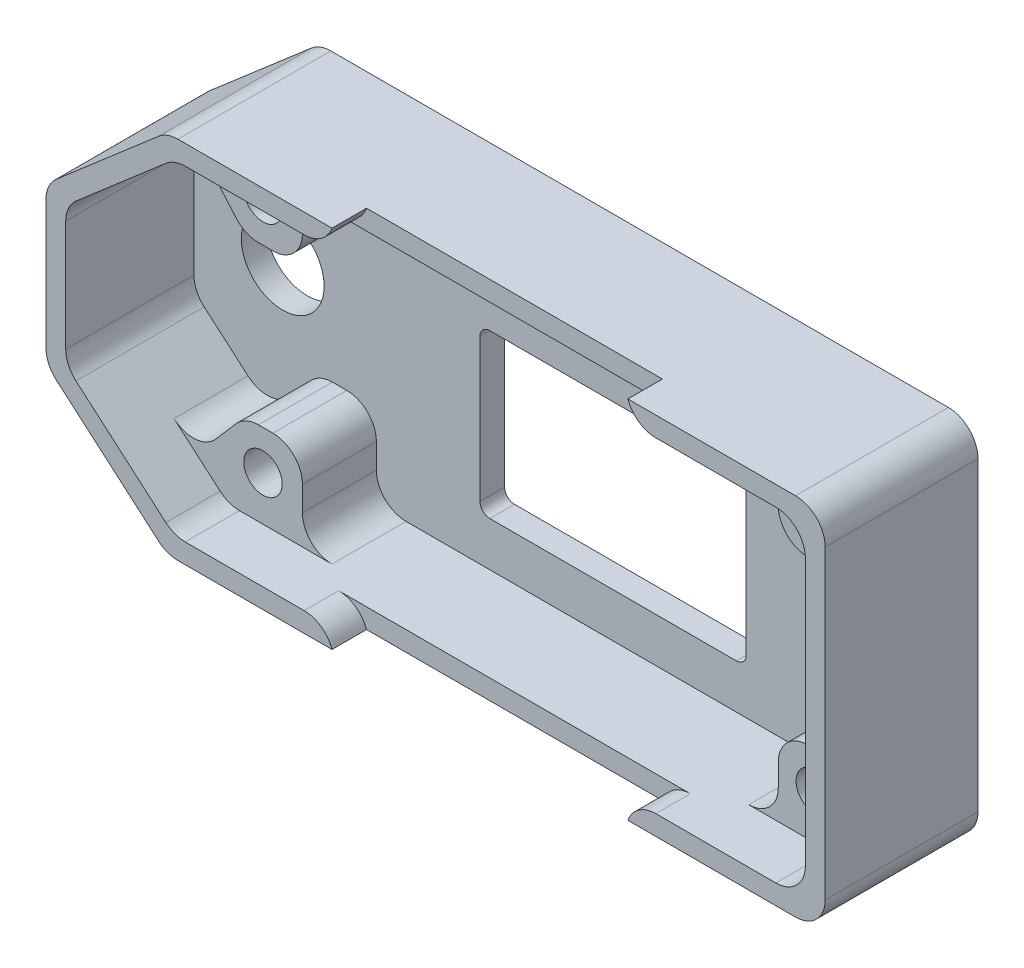
from build123d import *

# Parameters (mm, degrees)
BOSS_EXTRUDE1_DEPTH = 19.999999999999996
CUT_EXTRUDE1_DEPTH  = 17.5
CUT_EXTRUDE2_DEPTH  = 20
BOSS_EXTRUDE2_DEPTH = 7.5
SKETCH5_R           = 1.949999999999999
SKETCH5_R_2         = 1.949999999999998
SKETCH5_R_3         = 1.9499999999999986
CUT_EXTRUDE3_DEPTH  = 5.5
SKETCH6_R           = 4.199999999999999
CUT_EXTRUDE4_DEPTH  = 10
CUT_EXTRUDE5_DEPTH  = 2.5
CUT_EXTRUDE10_DEPTH = 7.5
SKETCH13_W          = 78.99999999999999
SKETCH13_H          = 37
CUT_EXTRUDE11_DEPTH = 4.5
CUT_EXTRUDE12_DEPTH = 3.5
SKETCH9_W           = 3.5
SKETCH9_H           = 15.000000000000004
CUT_EXTRUDE7_DEPTH  = 2.5
FILLET2_R           = 3
FILLET18_R          = 3
FILLET19_R          = 3
FILLET11_R          = 3
FILLET12_R          = 1
FILLET14_R          = 3
FILLET15_R          = 3
FILLET13_R          = 1
FILLET20_R          = 3


with BuildPart() as part:
    # Sketch1 → Boss-Extrude1 (new body)
    with BuildSketch(Plane.XY):
        Polygon((0, 0), (78.99999999999999, 0), (78.99999999999999, 37), (-6.72e-15, 37), align=None)
    extrude(amount=-BOSS_EXTRUDE1_DEPTH)

    # Sketch2 → Cut-Extrude1 (cut)
    with BuildSketch(Plane.XY):
        Polygon((76.99999999999999, 34.99999999999999), (12.999999999999984, 34.99999999999999), (1.9999999999999831, 25.499999999999996), (1.9999999999999718, 11.5), (13.000000000000004, 1.9999999999999922), (76.99999999999999, 2.0000000000000004), align=None)
    extrude(amount=-CUT_EXTRUDE1_DEPTH, mode=Mode.SUBTRACT)

    # Sketch3 → Cut-Extrude2 (cut)
    with BuildSketch(Plane.XY):
        Polygon((12.255906978158162, 37), (-6.72e-15, 26.41535306431793), (0, 37), align=None)
        Polygon((12.255906978158176, 1e-17), (1.389e-14, 10.584646935682041), (0, 0), align=None)
    extrude(amount=-CUT_EXTRUDE2_DEPTH, mode=Mode.SUBTRACT)

    # Sketch4 → Boss-Extrude2 (add)
    with BuildSketch(Plane.XY.offset(-17.5)):
        Polygon((76.99999999999999, 34.99999999999999), (68.74999999999999, 34.99999999999999), (68.74999999999999, 26.75), (76.99999999999997, 26.75), align=None)
        Polygon((12.999999999999984, 34.99999999999999), (20.49999999999999, 34.99999999999999), (20.49999999999999, 1.9999999999999922), (13.000000000000004, 1.9999999999999922), (1.9999999999999896, 11.49999999999998), (1.9999999999999882, 25.49999999999998), align=None)
        Polygon((76.99999999999999, 2), (68.74999999999999, 2.000000000000003), (68.74999999999999, 10.249999999999996), (76.99999999999999, 10.249999999999998), align=None)
    extrude(amount=BOSS_EXTRUDE2_DEPTH)

    # Sketch5 → Cut-Extrude3 (cut)
    with BuildSketch(Plane.XY.offset(-10.000000000000002)):
        with Locations((16.499999999999986, 30.5)):
            Circle(SKETCH5_R)
        with Locations((72.49999999999999, 30.5)):
            Circle(SKETCH5_R_2)
        with Locations((72.49999999999999, 6.499999999999999)):
            Circle(SKETCH5_R_3)
        with Locations((16.499999999999986, 6.499999999999985)):
            Circle(SKETCH5_R)
    extrude(amount=-CUT_EXTRUDE3_DEPTH, mode=Mode.SUBTRACT)

    # Sketch6 → Cut-Extrude4 (cut)
    with BuildSketch(Plane.XY.offset(-10.000000000000002)):
        with Locations((10.999999999999988, 18.5)):
            Circle(SKETCH6_R)
    extrude(amount=-CUT_EXTRUDE4_DEPTH, mode=Mode.SUBTRACT)

    # Sketch7 → Cut-Extrude5 (cut)
    with BuildSketch(Plane.XY.offset(-17.5)):
        Polygon((30.999999999999986, 23), (57.99999999999998, 23.000000000000004), (57.99999999999998, 6.500000000000003), (30.99999999999999, 6.499999999999999), align=None)
    extrude(amount=-CUT_EXTRUDE5_DEPTH, mode=Mode.SUBTRACT)

    # Sketch12 → Cut-Extrude10 (cut)
    with BuildSketch(Plane.XY.offset(-10.000000000000002)):
        Polygon((9.751406193775388, 32.19439625826063), (14.669293871364125, 26.5), (20.49999999999999, 26.5), (20.499999999999993, 10.499999999999986), (14.669293871364117, 10.499999999999986), (9.751406193775411, 4.805603741739363), (2.000000000000001, 11.499999999999991), (1.9999999999999862, 25.499999999999975), align=None)
    extrude(amount=-CUT_EXTRUDE10_DEPTH, mode=Mode.SUBTRACT)

    # Sketch13 → Cut-Extrude11 (cut)
    with BuildSketch(Plane.XY):
        with Locations((39.49999999999999, 18.5)):
            Rectangle(SKETCH13_W, SKETCH13_H)
    extrude(amount=-CUT_EXTRUDE11_DEPTH, mode=Mode.SUBTRACT)

    # Sketch14 → Cut-Extrude12 (cut)
    with BuildSketch(Plane.XY.offset(-4.5)):
        Polygon((28.999999999999986, 37), (58.999999999999986, 37.00000000000001), (58.999999999999986, 35), (28.999999999999986, 34.99999999999999), align=None)
        Polygon((28.999999999999986, 1.9999999999999931), (58.999999999999986, 1.9999999999999987), (58.999999999999986, 0), (28.999999999999986, -5.51e-15), align=None)
    extrude(amount=-CUT_EXTRUDE12_DEPTH, mode=Mode.SUBTRACT)

    # Sketch9 → Cut-Extrude7 (cut)
    with BuildSketch(Plane.XY.offset(-17.5)):
        with Locations((73.24999999999999, 18.75)):
            Rectangle(SKETCH9_W, SKETCH9_H)
    extrude(amount=-CUT_EXTRUDE7_DEPTH, mode=Mode.SUBTRACT)

    # Fillet2
    fillet2_edges = [part.edges().sort_by_distance(p)[0] for p in [
        (76.99999999999997, 26.75, -13.75),
        (68.74999999999999, 34.99999999999999, -13.75),
        (20.49999999999999, 1.9999999999999922, -13.75),
        (20.49999999999999, 34.99999999999999, -13.75),
        (76.99999999999999, 10.249999999999998, -13.75),
        (68.74999999999999, 2.000000000000003, -13.75),
    ]]
    fillet(fillet2_edges, radius=FILLET2_R)

    # Fillet18
    fillet18_edges = [part.edges().sort_by_distance(p)[0] for p in [
        (20.499999999999993, 10.499999999999986, -13.750000000000002),
        (20.49999999999999, 26.5, -13.750000000000002),
        (68.74999999999999, 26.75, -13.75),
        (68.74999999999999, 10.249999999999996, -13.75),
    ]]
    fillet(fillet18_edges, radius=FILLET18_R)

    # Fillet19
    fillet19_edges = [part.edges().sort_by_distance(p)[0] for p in [
        (9.751406193775411, 4.805603741739363, -13.750000000000002),
        (14.669293871364117, 10.499999999999986, -13.750000000000002),
        (14.669293871364125, 26.5, -13.750000000000002),
        (9.751406193775388, 32.19439625826063, -13.750000000000002),
    ]]
    fillet(fillet19_edges, radius=FILLET19_R)

    # Fillet11
    fillet11_edges = [part.edges().sort_by_distance(p)[0] for p in [
        (-6.72e-15, 26.41535306431793, -12.25),
        (12.255906978158162, 37, -12.25),
        (1.389e-14, 10.584646935682041, -12.25),
        (12.255906978158176, 1e-17, -12.25),
        (78.99999999999999, 37, -12.249999999999998),
        (78.99999999999999, 0, -12.249999999999998),
    ]]
    fillet(fillet11_edges, radius=FILLET11_R)

    # Fillet12
    fillet12_edges = [part.edges().sort_by_distance(p)[0] for p in [
        (57.99999999999998, 6.500000000000003, -18.75),
        (57.99999999999998, 23.000000000000004, -18.75),
        (30.999999999999986, 23, -18.75),
        (30.99999999999999, 6.499999999999999, -18.75),
    ]]
    fillet(fillet12_edges, radius=FILLET12_R)

    # Fillet14
    # the kernel refuses this fillet: 3 mm, written as the material it takes off along each edge
    with BuildSketch(Plane(origin=(58.999999999999986, 1.9999999999999982, 2.5710678118654613), x_dir=(-3.55e-15, -1, 0), z_dir=(0, 0, -1))) as fillet14_piece_1:
        with BuildLine():
            CenterArc((2.99999999999999, -2.828427124746195), FILLET14_R, 109.47122063449055, 70.52877936550925)
            Line((-1.027e-14, -2.8284271247461845), (-0.0600000000000101, -2.8284271247461845))
            Line((-0.0600000000000101, -2.8284271247461845), (-0.06000000000000005, 2.1e-16))
            Line((-0.06000000000000005, 2.1e-16), (2.1e-16, 0.06000000000000227))
            ThreePointArc((2.1e-16, 0.06000000000000227), (0.9999999999999986, 0.05999999999999872), (1.9799999999999969, 0.05656854249492234))
            Line((1.9799999999999969, 0.05656854249492234), (1.9999999999999967, 0))
        make_face()
    extrude(amount=10.571067811865461, mode=Mode.SUBTRACT)
    with BuildSketch(Plane(origin=(28.999999999999986, 1.9999999999999942, 2.571067811865479), x_dir=(0, -1, 0), z_dir=(0, 0, -1))) as fillet14_piece_2:
        with BuildLine():
            CenterArc((3, 2.8284271247461916), FILLET14_R, 180, 70.52877936550931)
            Line((2.2e-16, 2.8284271247461916), (-0.05999999999999961, 2.8284271247461916))
            Line((-0.05999999999999961, 2.8284271247461916), (-0.06000000000000005, 0))
            Line((-0.06000000000000005, 0), (0, -0.05999999999999872))
            ThreePointArc((0, -0.05999999999999872), (1.0000000000000002, -0.05999999999999872), (1.9800000000000004, -0.05656854249492227))
            Line((1.9800000000000004, -0.05656854249492227), (2.0000000000000004, 0))
        make_face()
    extrude(amount=10.571067811865479, mode=Mode.SUBTRACT)
    with BuildSketch(Plane(origin=(58.999999999999986, 34.99999999999999, 2.571067811865479), x_dir=(0, 1, 0), z_dir=(0, 0, -1))) as fillet14_piece_3:
        with BuildLine():
            CenterArc((3, 2.8284271247461916), FILLET14_R, 180, 70.52877936550954)
            Line((0, 2.8284271247461916), (-0.06000000000000227, 2.8284271247461916))
            Line((-0.06000000000000227, 2.8284271247461916), (-0.06000000000000227, 0))
            Line((-0.06000000000000227, 0), (0, -0.06000000000000227))
            ThreePointArc((0, -0.06000000000000227), (1.000000000000007, -0.06000000000000227), (1.980000000000011, -0.05656854249492227))
            Line((1.980000000000011, -0.05656854249492227), (2.000000000000014, 0))
        make_face()
    extrude(amount=10.571067811865479, mode=Mode.SUBTRACT)
    with BuildSketch(Plane(origin=(28.999999999999986, 34.99999999999999, 2.571067811865479), x_dir=(0, 1, 0), z_dir=(0, 0, -1))) as fillet14_piece_4:
        with BuildLine():
            CenterArc((3, -2.8284271247461916), FILLET14_R, 109.47122063449056, 70.52877936550944)
            Line((0, -2.8284271247461916), (-0.06000000000000227, -2.8284271247461916))
            Line((-0.06000000000000227, -2.8284271247461916), (-0.06000000000000227, 0))
            Line((-0.06000000000000227, 0), (0, 0.05999999999999872))
            ThreePointArc((0, 0.05999999999999872), (1.000000000000007, 0.05999999999999872), (1.980000000000004, 0.05656854249492227))
            Line((1.980000000000004, 0.05656854249492227), (2.000000000000007, 0))
        make_face()
    extrude(amount=10.571067811865479, mode=Mode.SUBTRACT)

    # Fillet15
    fillet15_edges = [part.edges().sort_by_distance(p)[0] for p in [
        (76.99999999999999, 34.99999999999999, -7.25),
        (12.999999999999984, 34.99999999999999, -7.25),
        (13.000000000000004, 1.9999999999999922, -7.25),
        (76.99999999999999, 2.0000000000000004, -7.25),
    ]]
    fillet(fillet15_edges, radius=FILLET15_R)

    # Fillet13
    fillet13_edges = [part.edges().sort_by_distance(p)[0] for p in [
        (74.99999999999999, 11.25, -18.75),
        (74.99999999999999, 26.25, -18.75),
        (71.49999999999999, 26.25, -18.75),
        (71.49999999999999, 11.25, -18.75),
    ]]
    fillet(fillet13_edges, radius=FILLET13_R)

    # Fillet20
    fillet20_edges = [part.edges().sort_by_distance(p)[0] for p in [
        (1.9999999999999851, 25.499999999999982, -11),
        (1.99999999999999, 11.499999999999995, -11),
    ]]
    fillet(fillet20_edges, radius=FILLET20_R)


solid = part.part
